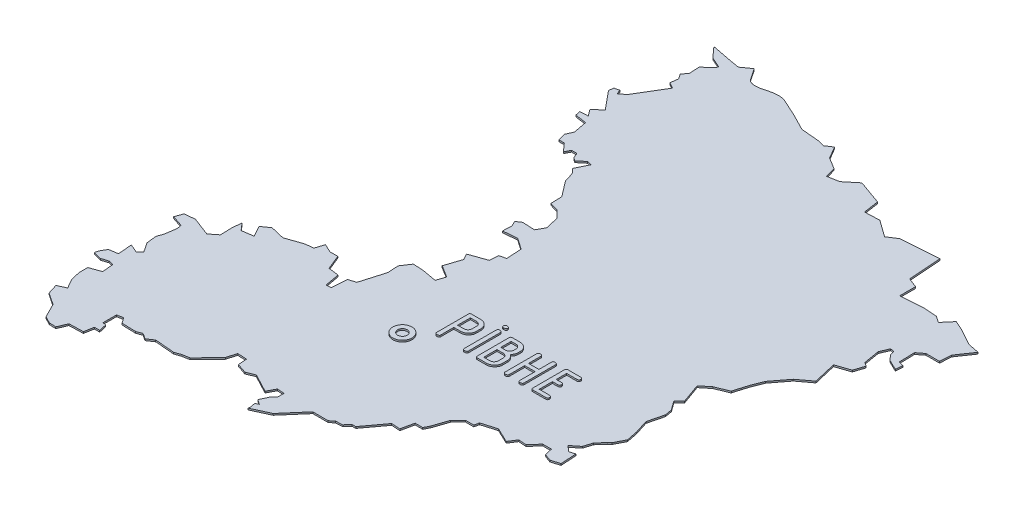
from build123d import *

# Parameters (mm, degrees)
EXTRUDE_1_DEPTH = 5
SKETCH_2_R      = 30
SKETCH_2_R_2    = 15
EXTRUDE_2_DEPTH = 10
SCALE_1_SCALE   = 0.05


with BuildPart() as part:
    # Эскиз1 → Бобышка-Вытянуть1 (new body)
    with BuildSketch(Plane(origin=(0, 0, 0), x_dir=(1, 0, 0), z_dir=(0, 1, 0))):
        with BuildLine():
            Line((-6732.93294, 8609.2792), (-6710.87304, 8600.84132))
            Line((-6710.87304, 8600.84132), (-6683.61884, 8609.2792))
            Line((-6683.61884, 8609.2792), (-6686.85734, 8658.57552))
            Line((-6686.85734, 8658.57552), (-6703.72802, 8653.39138))
            Line((-6703.72802, 8653.39138), (-6722.54434, 8668.97682))
            Line((-6722.54434, 8668.97682), (-6697.23578, 8689.086))
            Line((-6697.23578, 8689.086), (-6688.80298, 8716.35544))
            Line((-6688.80298, 8716.35544), (-6668.03848, 8739.05542))
            Line((-6668.03848, 8739.05542), (-6660.90362, 8745.54004))
            Line((-6660.90362, 8745.54004), (-6644.02786, 8777.99616))
            Line((-6644.02786, 8777.99616), (-6651.16272, 8813.69332))
            Line((-6651.16272, 8813.69332), (-6664.78728, 8856.50502))
            Line((-6664.78728, 8856.50502), (-6652.45812, 8905.84198))
            Line((-6652.45812, 8905.84198), (-6656.35194, 8927.90188))
            Line((-6656.35194, 8927.90188), (-6676.4789, 8955.80124))
            Line((-6676.4789, 8955.80124), (-6659.59806, 8972.68462))
            Line((-6659.59806, 8972.68462), (-6681.66812, 9034.31264))
            Line((-6681.66812, 9034.31264), (-6654.41392, 9056.37254))
            Line((-6654.41392, 9056.37254), (-6613.51484, 9073.26862))
            add(Edge.make_bspline(
                [(-6606.37744, 9098.56702), (-6610.27126, 9084.94246), (-6613.51484, 9073.26862)],
                knots=[0.914893617, 0.914893617, 0.914893617, 0.919148936, 0.919148936, 0.919148936], degree=2))
            add(Edge.make_bspline(
                [(-6586.2835, 9153.72566), (-6603.14402, 9112.83166), (-6606.37744, 9098.56702)],
                knots=[0.910638298, 0.910638298, 0.910638298, 0.914893617, 0.914893617, 0.914893617], degree=2))
            Line((-6586.2835, 9153.72566), (-6548.65086, 9203.03468))
            Line((-6548.65086, 9203.03468), (-6507.7467, 9233.5477))
            Line((-6507.7467, 9233.5477), (-6524.62246, 9305.57956))
            Line((-6524.62246, 9305.57956), (-6480.4925, 9320.50714))
            Line((-6480.4925, 9320.50714), (-6470.11914, 9352.95818))
            Line((-6470.11914, 9352.95818), (-6481.8006, 9361.38082))
            Line((-6481.8006, 9361.38082), (-6490.22832, 9411.35532))
            Line((-6490.22832, 9411.35532), (-6478.5621, 9438.61714))
            Line((-6478.5621, 9438.61714), (-6466.86794, 9436.65118))
            Line((-6466.86794, 9436.65118), (-6462.9792, 9423.04186))
            Line((-6462.9792, 9423.04186), (-6448.04654, 9406.14324))
            Line((-6448.04654, 9406.14324), (-6415.59042, 9390.58574))
            Line((-6415.59042, 9390.58574), (-6413.66002, 9412.65072))
            Line((-6413.66002, 9412.65072), (-6429.23276, 9416.55216))
            Line((-6429.23276, 9416.55216), (-6430.5307, 9465.85356))
            Line((-6430.5307, 9465.85356), (-6410.4139, 9481.4517))
            Line((-6410.4139, 9481.4517), (-6367.5895, 9481.4517))
            Line((-6367.5895, 9481.4517), (-6365.63878, 9517.126))
            Line((-6365.63878, 9517.126), (-6331.8771, 9566.45534))
            Line((-6331.8771, 9566.45534), (-6367.5895, 9573.58512))
            Line((-6367.5895, 9573.58512), (-6418.84924, 9602.13472))
            Line((-6418.84924, 9602.13472), (-6449.35464, 9615.78468))
            Line((-6449.35464, 9615.78468), (-6475.30328, 9585.26658))
            Line((-6475.30328, 9585.26658), (-6495.41754, 9598.89622))
            Line((-6495.41754, 9598.89622), (-6538.26226, 9602.13472))
            Line((-6538.26226, 9602.13472), (-6608.32562, 9596.9455))
            Line((-6608.32562, 9596.9455), (-6608.32562, 9646.92254))
            Line((-6608.32562, 9646.92254), (-6638.84118, 9658.60654))
            Line((-6638.84118, 9658.60654), (-6645.97858, 9761.13618))
            Line((-6645.97858, 9761.13618), (-6763.44596, 9752.69576))
            Line((-6763.44596, 9752.69576), (-6792.6331, 9733.88198))
            Line((-6792.6331, 9733.88198), (-6845.1984, 9771.51716))
            Line((-6845.1984, 9771.51716), (-6891.27908, 9769.54866))
            Line((-6891.27908, 9769.54866), (-6898.40886, 9817.58514))
            Line((-6898.40886, 9817.58514), (-6974.97716, 9844.84442))
            Line((-6974.97716, 9844.84442), (-7012.60726, 9813.69132))
            Line((-7012.60726, 9813.69132), (-7048.31458, 9807.2194))
            Line((-7048.31458, 9807.2194), (-7057.40778, 9839.65012))
            Line((-7057.40778, 9839.65012), (-7093.08716, 9861.72272))
            Line((-7093.08716, 9861.72272), (-7115.16484, 9899.38076))
            Line((-7115.16484, 9899.38076), (-7135.92426, 9885.72572))
            Line((-7135.92426, 9885.72572), (-7156.03852, 9890.92764))
            Line((-7156.03852, 9890.92764), (-7214.45852, 9896.11178))
            Line((-7214.45852, 9896.11178), (-7270.25216, 9924.66646))
            Line((-7270.25216, 9924.66646), (-7323.455, 9948.68978))
            add(Edge.make_bspline(
                [(-7379.91666, 9945.43604), (-7345.53522, 9955.81448), (-7323.455, 9948.68978)],
                knots=[0.714893617, 0.714893617, 0.714893617, 0.719148936, 0.719148936, 0.719148936], degree=2))
            add(Edge.make_bspline(
                [(-7429.25362, 9948.68978), (-7413.68088, 9935.05252), (-7379.91666, 9945.43604)],
                knots=[0.710638298, 0.710638298, 0.710638298, 0.714893617, 0.714893617, 0.714893617], degree=2))
            Line((-7429.25362, 9948.68978), (-7454.55456, 9986.31226))
            Line((-7454.55456, 9986.31226), (-7483.76456, 9965.54014))
            Line((-7483.76456, 9965.54014), (-7514.23948, 9970.72936))
            Line((-7514.23948, 9970.72936), (-7577.85378, 9983.07122))
            Line((-7577.85378, 9983.07122), (-7548.64886, 9950.63288))
            Line((-7548.64886, 9950.63288), (-7514.23948, 9935.05252))
            Line((-7514.23948, 9935.05252), (-7524.64332, 9921.42034))
            Line((-7524.64332, 9921.42034), (-7545.39004, 9904.5395))
            Line((-7545.39004, 9904.5395), (-7543.44694, 9872.08846))
            Line((-7543.44694, 9872.08846), (-7555.78626, 9855.23048))
            Line((-7555.78626, 9855.23048), (-7545.39004, 9839.65012))
            Line((-7545.39004, 9839.65012), (-7548.64886, 9815.64204))
            Line((-7548.64886, 9815.64204), (-7529.83254, 9805.2636))
            Line((-7529.83254, 9805.2636), (-7583.0303, 9716.99352))
            Line((-7583.0303, 9716.99352), (-7601.86186, 9702.72126))
            Line((-7601.86186, 9702.72126), (-7606.3983, 9716.99352))
            Line((-7606.3983, 9716.99352), (-7621.98374, 9713.10478))
            Line((-7621.98374, 9713.10478), (-7623.93954, 9698.18482))
            Line((-7623.93954, 9698.18482), (-7575.90814, 9639.78768))
            Line((-7575.90814, 9639.78768), (-7601.86186, 9617.72778))
            Line((-7601.86186, 9617.72778), (-7586.28658, 9596.9455))
            Line((-7586.28658, 9596.9455), (-7611.59768, 9595.64502))
            Line((-7611.59768, 9595.64502), (-7608.34648, 9580.08752))
            Line((-7608.34648, 9580.08752), (-7572.66202, 9574.89322))
            Line((-7572.66202, 9574.89322), (-7564.2216, 9532.05866))
            Line((-7564.2216, 9532.05866), (-7573.95488, 9509.99114))
            Line((-7573.95488, 9509.99114), (-7567.45756, 9485.98052))
            Line((-7567.45756, 9485.98052), (-7550.60212, 9485.98052))
            Line((-7550.60212, 9485.98052), (-7527.88436, 9460.67196))
            Line((-7527.88436, 9460.67196), (-7519.44394, 9477.5401))
            Line((-7519.44394, 9477.5401), (-7502.57834, 9477.5401))
            Line((-7502.57834, 9477.5401), (-7495.4384, 9460.67196))
            Line((-7495.4384, 9460.67196), (-7485.69242, 9454.1848))
            Line((-7485.69242, 9454.1848), (-7463.62998, 9472.36358))
            Line((-7463.62998, 9472.36358), (-7449.3755, 9469.11746))
            Line((-7449.3755, 9469.11746), (-7468.18928, 9430.15894))
            Line((-7468.18928, 9430.15894), (-7454.55456, 9414.60652))
            Line((-7454.55456, 9414.60652), (-7446.09382, 9385.39652))
            Line((-7446.09382, 9385.39652), (-7408.48658, 9336.0875))
            Line((-7408.48658, 9336.0875), (-7407.17848, 9300.38018))
            Line((-7407.17848, 9300.38018), (-7381.21206, 9293.25294))
            Line((-7381.21206, 9293.25294), (-7357.20906, 9269.24994))
            Line((-7357.20906, 9269.24994), (-7347.46562, 9228.3534))
            Line((-7347.46562, 9228.3534), (-7361.11304, 9203.03468))
            Line((-7361.11304, 9203.03468), (-7400.03854, 9204.9854))
            Line((-7400.03854, 9204.9854), (-7415.61382, 9194.61712))
            Line((-7415.61382, 9194.61712), (-7407.17848, 9179.03168))
            Line((-7407.17848, 9179.03168), (-7408.48658, 9149.83184))
            Line((-7408.48658, 9149.83184), (-7364.35408, 9153.72566))
            Line((-7364.35408, 9153.72566), (-7329.9574, 9129.70996))
            Line((-7329.9574, 9129.70996), (-7326.70112, 9081.69126))
            Line((-7326.70112, 9081.69126), (-7347.46562, 9076.50966))
            Line((-7347.46562, 9076.50966), (-7348.77372, 9049.26054))
            Line((-7348.77372, 9049.26054), (-7401.98672, 9030.42644))
            Line((-7401.98672, 9030.42644), (-7391.6032, 9011.61266))
            Line((-7391.6032, 9011.61266), (-7408.48658, 8960.35292))
            Line((-7408.48658, 8960.35292), (-7370.83362, 8936.97984))
            Line((-7370.83362, 8936.97984), (-7379.91666, 8909.71802))
            Line((-7379.91666, 8909.71802), (-7427.28766, 8918.16606))
            Line((-7427.28766, 8918.16606), (-7458.45346, 8919.46654))
            Line((-7458.45346, 8919.46654), (-7477.26216, 8890.90424))
            Line((-7477.26216, 8890.90424), (-7475.31144, 8856.50502))
            Line((-7475.31144, 8856.50502), (-7497.38912, 8781.2372))
            Line((-7497.38912, 8781.2372), (-7519.44394, 8774.73988))
            Line((-7519.44394, 8774.73988), (-7523.33522, 8726.70848))
            Line((-7523.33522, 8726.70848), (-7538.26788, 8725.43086))
            Line((-7538.26788, 8725.43086), (-7546.69814, 8771.50138))
            Line((-7546.69814, 8771.50138), (-7579.14156, 8776.0429))
            Line((-7579.14156, 8776.0429), (-7597.98074, 8822.11088))
            Line((-7597.98074, 8822.11088), (-7621.98374, 8822.11088))
            Line((-7621.98374, 8822.11088), (-7649.22778, 8834.45274))
            Line((-7649.22778, 8834.45274), (-7657.6682, 8807.20362))
            Line((-7657.6682, 8807.20362), (-7683.61684, 8803.93718))
            Line((-7683.61684, 8803.93718), (-7734.89182, 8786.43404))
            Line((-7734.89182, 8786.43404), (-7779.0294, 8796.80486))
            Line((-7779.0294, 8796.80486), (-7803.0324, 8779.93418))
            Line((-7803.0324, 8779.93418), (-7784.20592, 8745.54004))
            Line((-7784.20592, 8745.54004), (-7819.90816, 8740.36352))
            Line((-7819.90816, 8740.36352), (-7838.72702, 8762.40564))
            Line((-7838.72702, 8762.40564), (-7841.9579, 8735.16922))
            Line((-7841.9579, 8735.16922), (-7840.66504, 8696.22086))
            Line((-7840.66504, 8696.22086), (-7864.67566, 8677.402))
            Line((-7864.67566, 8677.402), (-7922.42002, 8699.47206))
            Line((-7922.42002, 8699.47206), (-7954.88122, 8696.22086))
            Line((-7954.88122, 8696.22086), (-7963.33688, 8672.2331))
            Line((-7963.33688, 8672.2331), (-7928.92242, 8660.5364))
            Line((-7928.92242, 8660.5364), (-7925.6763, 8646.90676))
            Line((-7925.6763, 8646.90676), (-7930.87314, 8610.56952))
            Line((-7930.87314, 8610.56952), (-7938.00038, 8590.44764))
            Line((-7938.00038, 8590.44764), (-7934.11926, 8559.292))
            Line((-7934.11926, 8559.292), (-7914.01008, 8528.80692))
            Line((-7914.01008, 8528.80692), (-7925.6763, 8517.12292))
            Line((-7925.6763, 8517.12292), (-7952.92796, 8528.80692))
            Line((-7952.92796, 8528.80692), (-7949.68692, 8484.68966))
            Line((-7949.68692, 8484.68966), (-7976.93604, 8480.77806))
            Line((-7976.93604, 8480.77806), (-7987.3348, 8462.60436))
            Line((-7987.3348, 8462.60436), (-7990.57076, 8450.26504))
            Line((-7990.57076, 8450.26504), (-7965.2622, 8443.7982))
            Line((-7965.2622, 8443.7982), (-7944.50278, 8450.26504))
            Line((-7944.50278, 8450.26504), (-7928.92242, 8447.04178))
            Line((-7928.92242, 8447.04178), (-7925.6763, 8411.337))
            Line((-7925.6763, 8411.337), (-7960.07298, 8399.02308))
            Line((-7960.07298, 8399.02308), (-7960.07298, 8371.75872))
            Line((-7960.07298, 8371.75872), (-7952.92796, 8341.2584))
            Line((-7952.92796, 8341.2584), (-7936.04966, 8312.04586))
            Line((-7936.04966, 8312.04586), (-7961.37346, 8300.37202))
            Line((-7961.37346, 8300.37202), (-7951.62494, 8269.22654))
            Line((-7951.62494, 8269.22654), (-7914.01008, 8243.92306))
            Line((-7914.01008, 8243.92306), (-7891.94256, 8199.78548))
            Line((-7891.94256, 8199.78548), (-7870.5075, 8188.75934))
            Line((-7870.5075, 8188.75934), (-7849.10038, 8187.45632))
            Line((-7849.10038, 8187.45632), (-7836.76868, 8216.66632))
            Line((-7836.76868, 8216.66632), (-7792.64634, 8217.95918))
            Line((-7792.64634, 8217.95918), (-7787.44696, 8247.17426))
            Line((-7787.44696, 8247.17426), (-7770.59406, 8247.17426))
            Line((-7770.59406, 8247.17426), (-7775.7655, 8271.17726))
            Line((-7775.7655, 8271.17726), (-7786.16426, 8273.11528))
            Line((-7786.16426, 8273.11528), (-7786.16426, 8315.30976))
            Line((-7786.16426, 8315.30976), (-7767.34794, 8319.1858))
            Line((-7767.34794, 8319.1858), (-7755.0137, 8301.6725))
            Line((-7755.0137, 8301.6725), (-7710.89644, 8300.37202))
            Line((-7710.89644, 8300.37202), (-7694.01814, 8306.8668))
            Line((-7694.01814, 8306.8668), (-7676.49468, 8295.1828))
            Line((-7676.49468, 8295.1828), (-7656.3728, 8308.8099))
            Line((-7656.3728, 8308.8099), (-7594.72192, 8303.62322))
            Line((-7594.72192, 8303.62322), (-7575.90814, 8310.118))
            Line((-7575.90814, 8310.118), (-7553.84316, 8314.00674))
            Line((-7553.84316, 8314.00674), (-7499.33984, 8370.47348))
            Line((-7499.33984, 8370.47348), (-7490.9045, 8400.9611))
            Line((-7490.9045, 8400.9611), (-7461.69196, 8399.02308))
            Line((-7461.69196, 8399.02308), (-7459.74378, 8371.75872))
            Line((-7459.74378, 8371.75872), (-7429.25362, 8361.38028))
            Line((-7429.25362, 8361.38028), (-7403.28212, 8371.75872))
            Line((-7403.28212, 8371.75872), (-7345.53522, 8341.2584))
            Line((-7345.53522, 8341.2584), (-7331.89542, 8366.57458))
            Line((-7331.89542, 8366.57458), (-7309.84822, 8365.26648))
            Line((-7309.84822, 8365.26648), (-7309.84822, 8346.45778))
            Line((-7309.84822, 8346.45778), (-7320.2165, 8336.08442))
            Line((-7320.2165, 8336.08442), (-7333.84868, 8306.8668))
            Line((-7333.84868, 8306.8668), (-7318.27848, 8296.47058))
            Line((-7318.27848, 8296.47058), (-7328.65184, 8291.94176))
            Line((-7328.65184, 8291.94176), (-7324.75802, 8276.35632))
            Line((-7324.75802, 8276.35632), (-7326.06612, 8268.57884))
            Line((-7326.06612, 8268.57884), (-7272.19018, 8293.23716))
            Line((-7272.19018, 8293.23716), (-7214.45852, 8360.07218))
            Line((-7214.45852, 8360.07218), (-7166.42712, 8360.07218))
            Line((-7166.42712, 8360.07218), (-7152.78478, 8370.47348))
            Line((-7152.78478, 8370.47348), (-7132.02282, 8371.75872))
            Line((-7132.02282, 8371.75872), (-7118.41096, 8387.33654))
            Line((-7118.41096, 8387.33654), (-7106.70664, 8387.33654))
            Line((-7106.70664, 8387.33654), (-7058.68794, 8452.21322))
            Line((-7058.68794, 8452.21322), (-7031.45406, 8450.26504))
            Line((-7031.45406, 8450.26504), (-7023.00856, 8489.8738))
            Line((-7023.00856, 8489.8738), (-6999.00302, 8489.8738))
            Line((-6999.00302, 8489.8738), (-6990.56514, 8506.74194))
            Line((-6990.56514, 8506.74194), (-6974.97716, 8552.81246))
            Line((-6974.97716, 8552.81246), (-6951.61678, 8576.83324))
            Line((-6951.61678, 8576.83324), (-6925.65544, 8576.83324))
            Line((-6925.65544, 8576.83324), (-6922.40678, 8591.74812))
            Line((-6922.40678, 8591.74812), (-6876.3642, 8605.3676))
            Line((-6876.3642, 8605.3676), (-6830.26574, 8583.3077))
            Line((-6830.26574, 8583.3077), (-6814.69046, 8607.32086))
            Line((-6814.69046, 8607.32086), (-6790.68238, 8605.3676))
            Line((-6790.68238, 8605.3676), (-6765.37128, 8633.27966))
            Line((-6765.37128, 8633.27966), (-6738.13486, 8633.27966))
            Line((-6738.13486, 8633.27966), (-6732.93294, 8609.2792))
        make_face()
    extrude(amount=EXTRUDE_1_DEPTH)

    # Эскиз2 → Бобышка-Вытянуть2 (add)
    # profile 1 of 7: a face of its own
    with BuildSketch(Plane(origin=(0, 0, 0), x_dir=(1, 0, 0), z_dir=(0, 1, 0))):
        with Locations((-7284.487874878, 8711.551338167)):
            Circle(SKETCH_2_R)
        with Locations((-7284.487874878, 8711.551338167)):
            Circle(SKETCH_2_R_2, mode=Mode.SUBTRACT)
    # profile 2 of 7: a face of its own
    with BuildSketch(Plane(origin=(0, 0, 0), x_dir=(1, 0, 0), z_dir=(0, 1, 0))):
        with BuildLine():
            Line((-7217.592863068, 8806.062785371), (-7217.592863068, 8765.30053875))
            add(Edge.make_bspline(
                [(-7217.592863068, 8765.30053875), (-7217.611304209, 8764.879284244), (-7217.646198195, 8764.082194279), (-7218.014926466, 8762.968559189), (-7218.59727321, 8762.012744442), (-7219.451860644, 8761.249927037), (-7220.526456164, 8760.669117692), (-7221.824445643, 8760.252649125), (-7223.353883844, 8760.040077429), (-7224.444059997, 8760.002003623), (-7225.0252955, 8759.98170429)],
                knots=[0, 0, 0, 0, 0.969647621, 1.834749252, 2.678145047, 3.526077294, 4.446504318, 5.481227067, 6.657097526, 8, 8, 8, 8], degree=3))
            add(Edge.make_bspline(
                [(-7225.0252955, 8759.98170429), (-7225.490553924, 8760.001981841), (-7226.365515249, 8760.040115644), (-7227.597273432, 8760.255393411), (-7228.641217934, 8760.677563574), (-7229.504421752, 8761.266956602), (-7230.183877964, 8762.037716429), (-7230.639483304, 8762.986867721), (-7230.9294974, 8764.091392324), (-7230.956736686, 8764.880397906), (-7230.971241446, 8765.30053875)],
                knots=[0, 0, 0, 0, 1.22289028, 2.299757822, 3.266537475, 4.157864275, 5.022578284, 5.932048079, 6.898827733, 8, 8, 8, 8], degree=3))
            Line((-7230.971241446, 8765.30053875), (-7230.971241446, 8864.662869831))
            add(Edge.make_bspline(
                [(-7230.971241446, 8864.662869831), (-7230.954859504, 8865.082668509), (-7230.924168328, 8865.869151285), (-7230.660203114, 8866.969690974), (-7230.253731033, 8867.912958884), (-7229.65038393, 8868.694070153), (-7228.85880179, 8869.278938553), (-7227.910002173, 8869.70585097), (-7226.7845348, 8869.924542846), (-7225.986138424, 8869.96179693), (-7225.559501581, 8869.98170429)],
                knots=[0, 0, 0, 0, 1.157077194, 2.167756429, 3.10506564, 3.97280776, 4.857486845, 5.794796055, 6.821611322, 8, 8, 8, 8], degree=3))
            Line((-7225.559501581, 8869.98170429), (-7198.105954284, 8869.98170429))
            add(Edge.make_bspline(
                [(-7198.105954284, 8869.98170429), (-7197.175499892, 8869.961564268), (-7195.354267809, 8869.92214304), (-7192.684614611, 8869.548173566), (-7190.122260249, 8869.02035552), (-7187.693733441, 8868.175027555), (-7185.353740625, 8867.178177889), (-7183.168640109, 8865.865261207), (-7181.062668794, 8864.394850604), (-7179.137665594, 8862.667987365), (-7177.352451209, 8860.832574123), (-7175.79831205, 8858.886342885), (-7174.481151521, 8856.86128463), (-7173.381879309, 8854.776869837), (-7172.535522686, 8852.603046042), (-7171.966986929, 8850.346467353), (-7171.570380374, 8848.031236694), (-7171.531369162, 8846.45508559), (-7171.511781987, 8845.663714425)],
                knots=[0, 0, 0, 0, 1.115359705, 2.183157925, 3.228715987, 4.24774915, 5.262329495, 6.273717254, 7.299288291, 8.338890594, 9.370038504, 10.367862649, 11.320905581, 12.263804873, 13.189908176, 14.111156383, 15.051628764, 16, 16, 16, 16], degree=3))
            Line((-7171.511781987, 8845.663714425), (-7171.511781987, 8830.311096182))
            add(Edge.make_bspline(
                [(-7171.511781987, 8830.311096182), (-7171.533570809, 8829.52008595), (-7171.576723322, 8827.953499259), (-7171.937824636, 8825.641575581), (-7172.517567355, 8823.399127483), (-7173.338077184, 8821.228408453), (-7174.38218889, 8819.130423969), (-7175.684567748, 8817.120237497), (-7177.186234993, 8815.164870581), (-7178.929009661, 8813.332258944), (-7180.79944455, 8811.603341712), (-7182.86660058, 8810.155443769), (-7185.010603237, 8808.870656789), (-7187.303415702, 8807.863030041), (-7189.697452714, 8807.029171261), (-7192.226851249, 8806.492925313), (-7194.858889978, 8806.12401528), (-7196.656837356, 8806.083435145), (-7197.571748203, 8806.062785371)],
                knots=[0, 0, 0, 0, 0.959067182, 1.899421552, 2.831059805, 3.764258791, 4.709244439, 5.667943704, 6.665417502, 7.695258647, 8.732566372, 9.748959613, 10.750800674, 11.759659972, 12.7812896, 13.820296438, 14.890827142, 16, 16, 16, 16], degree=3))
            Line((-7197.571748203, 8806.062785371), (-7217.592863068, 8806.062785371))
        make_face()
        with BuildLine():
            Line((-7217.592863068, 8817.954677263), (-7198.314991446, 8817.954677263))
            add(Edge.make_bspline(
                [(-7198.314991446, 8817.954677263), (-7197.426856432, 8817.994693544), (-7195.68161219, 8818.073328192), (-7193.184651367, 8818.833716554), (-7190.86880651, 8820.017224621), (-7188.819553005, 8821.657938573), (-7187.074036988, 8823.597711391), (-7185.810938566, 8825.814428687), (-7185.036664496, 8828.224394276), (-7184.939392305, 8829.902874924), (-7184.890160365, 8830.752396858)],
                knots=[0, 0, 0, 0, 1.033886494, 2.031655573, 3.017574438, 4.053235711, 5.077365722, 6.044435782, 7.010238993, 8, 8, 8, 8], degree=3))
            Line((-7184.890160365, 8830.752396858), (-7184.890160365, 8845.22241375))
            add(Edge.make_bspline(
                [(-7184.890160365, 8845.22241375), (-7184.939969846, 8846.071598866), (-7185.038383138, 8847.749414031), (-7185.805434561, 8850.168002592), (-7187.107135092, 8852.373626247), (-7188.838302032, 8854.331812309), (-7190.874367504, 8856.015550785), (-7193.191748294, 8857.203093948), (-7195.688281573, 8857.974087927), (-7197.426593749, 8858.050672425), (-7198.314991446, 8858.089812398)],
                knots=[0, 0, 0, 0, 0.988107596, 1.952297418, 2.922249424, 3.951448995, 4.983962972, 5.98039188, 6.967840629, 8, 8, 8, 8], degree=3))
            Line((-7198.314991446, 8858.089812398), (-7217.592863068, 8858.089812398))
            Line((-7217.592863068, 8858.089812398), (-7217.592863068, 8817.954677263))
        make_face(mode=Mode.SUBTRACT)
    # profile 3 of 7: a face of its own
    with BuildSketch(Plane(origin=(0, 0, 0), x_dir=(1, 0, 0), z_dir=(0, 1, 0))):
        with BuildLine():
            add(Edge.make_bspline(
                [(-7130.484754959, 8765.323765101), (-7130.504719258, 8764.903077801), (-7130.54284569, 8764.099678417), (-7130.894876668, 8762.97829843), (-7131.497104348, 8762.032285915), (-7132.348892144, 8761.275902038), (-7133.411018735, 8760.66341415), (-7134.717513307, 8760.254848964), (-7136.245414805, 8760.039402137), (-7137.335826375, 8760.001768789), (-7137.917187392, 8759.98170429)],
                knots=[0, 0, 0, 0, 0.968349646, 1.849286893, 2.676465977, 3.523263178, 4.451261044, 5.484598709, 6.658895142, 8, 8, 8, 8], degree=3))
            add(Edge.make_bspline(
                [(-7137.917187392, 8759.98170429), (-7138.382572889, 8760.001796095), (-7139.257773186, 8760.039580585), (-7140.487955799, 8760.257161405), (-7141.541216731, 8760.673515565), (-7142.390158453, 8761.292025807), (-7143.069142873, 8762.055602517), (-7143.541656145, 8762.998446479), (-7143.817258863, 8764.108248113), (-7143.847291812, 8764.904018754), (-7143.863133338, 8765.323765101)],
                knots=[0, 0, 0, 0, 1.220860227, 2.29594012, 3.261114875, 4.162696787, 5.025975332, 5.915822489, 6.900655729, 8, 8, 8, 8], degree=3))
            Line((-7143.863133338, 8765.323765101), (-7143.863133338, 8865.33643402))
            add(Edge.make_bspline(
                [(-7143.863133338, 8865.33643402), (-7143.84711602, 8865.756012063), (-7143.816749798, 8866.551463627), (-7143.543376297, 8867.663399526), (-7143.060739121, 8868.604388769), (-7142.405985778, 8869.393640527), (-7141.531703687, 8869.981539216), (-7140.489600799, 8870.405145239), (-7139.25727535, 8870.619980724), (-7138.382400065, 8870.658181609), (-7137.917187392, 8870.678494831)],
                knots=[0, 0, 0, 0, 1.098843442, 2.08322802, 2.972669788, 3.850929026, 4.740370794, 5.705105844, 6.779695961, 8, 8, 8, 8], degree=3))
            add(Edge.make_bspline(
                [(-7137.917187392, 8870.678494831), (-7137.33601047, 8870.658139097), (-7136.245944192, 8870.619959503), (-7134.71578877, 8870.408078344), (-7133.420056971, 8869.989436094), (-7132.333618171, 8869.413018051), (-7131.50518545, 8868.62625222), (-7130.893412149, 8867.683629773), (-7130.543265053, 8866.560025585), (-7130.504863383, 8865.75695116), (-7130.484754959, 8865.33643402)],
                knots=[0, 0, 0, 0, 1.340544031, 2.514349394, 3.547254935, 4.466065479, 5.324653274, 6.151486447, 7.032055301, 8, 8, 8, 8], degree=3))
            Line((-7130.484754959, 8865.33643402), (-7130.484754959, 8765.323765101))
        make_face()
    # profile 4 of 7: a face of its own
    with BuildSketch(Plane(origin=(0, 0, 0), x_dir=(1, 0, 0), z_dir=(0, 1, 0))):
        with BuildLine():
            add(Edge.make_bspline(
                [(-7137.917187392, 8893.765488074), (-7137.335951889, 8893.745188742), (-7136.245775736, 8893.707114935), (-7134.716337535, 8893.494543239), (-7133.418348056, 8893.078074672), (-7132.343752536, 8892.497265327), (-7131.489165101, 8891.734447923), (-7130.906818358, 8890.778633176), (-7130.538090087, 8889.664998086), (-7130.503196101, 8888.86790812), (-7130.484754959, 8888.446653615)],
                knots=[0, 0, 0, 0, 1.342902474, 2.518772933, 3.553495682, 4.473922706, 5.321854953, 6.165250748, 7.030352379, 8, 8, 8, 8], degree=3))
            add(Edge.make_bspline(
                [(-7130.484754959, 8888.446653615), (-7130.503715641, 8888.018025879), (-7130.539614408, 8887.206493495), (-7130.899912915, 8886.072736177), (-7131.496875742, 8885.11267397), (-7132.33469259, 8884.324616299), (-7133.419486757, 8883.745437291), (-7134.718208849, 8883.335269881), (-7136.243217144, 8883.084439079), (-7137.335491629, 8883.052123539), (-7137.917187392, 8883.03491375)],
                knots=[0, 0, 0, 0, 0.981339183, 1.857995784, 2.696169867, 3.550943068, 4.465671455, 5.493987931, 6.665411832, 8, 8, 8, 8], degree=3))
            add(Edge.make_bspline(
                [(-7137.917187392, 8883.03491375), (-7138.383024699, 8883.052174532), (-7139.260607905, 8883.084691835), (-7140.486662857, 8883.338047656), (-7141.532264636, 8883.753327576), (-7142.405132275, 8884.34379751), (-7143.068098605, 8885.136080656), (-7143.537455343, 8886.091836474), (-7143.819893585, 8887.215333707), (-7143.848117634, 8888.019057864), (-7143.863133338, 8888.446653615)],
                knots=[0, 0, 0, 0, 1.213876563, 2.286801999, 3.246455683, 4.131212664, 5.004846013, 5.90761226, 6.886811976, 8, 8, 8, 8], degree=3))
            add(Edge.make_bspline(
                [(-7143.863133338, 8888.446653615), (-7143.848628578, 8888.866794459), (-7143.821389291, 8889.655800041), (-7143.531375196, 8890.760324643), (-7143.075769855, 8891.709475936), (-7142.396313644, 8892.480235762), (-7141.533109825, 8893.06962879), (-7140.489165324, 8893.491798953), (-7139.257407141, 8893.707076721), (-7138.382445816, 8893.745210523), (-7137.917187392, 8893.765488074)],
                knots=[0, 0, 0, 0, 1.101172267, 2.067951921, 2.977421716, 3.842135725, 4.733462525, 5.700242178, 6.77710972, 8, 8, 8, 8], degree=3))
        make_face()
    # profile 5 of 7: a face of its own
    with BuildSketch(Plane(origin=(0, 0, 0), x_dir=(1, 0, 0), z_dir=(0, 1, 0))):
        with BuildLine():
            add(Edge.make_bspline(
                [(-7097.424366446, 8759.98170429), (-7097.851003289, 8760.001611651), (-7098.649399665, 8760.038865735), (-7099.774867038, 8760.257557611), (-7100.723666655, 8760.684470028), (-7101.515248795, 8761.269338427), (-7102.118595897, 8762.050449697), (-7102.525067979, 8762.993717607), (-7102.789033193, 8764.094257296), (-7102.819724369, 8764.880740072), (-7102.836106311, 8765.30053875)],
                knots=[0, 0, 0, 0, 1.178388678, 2.205203945, 3.142513155, 4.02719224, 4.89493436, 5.832243571, 6.842922806, 8, 8, 8, 8], degree=3))
            Line((-7102.836106311, 8765.30053875), (-7102.836106311, 8864.662869831))
            add(Edge.make_bspline(
                [(-7102.836106311, 8864.662869831), (-7102.81686545, 8865.082135085), (-7102.78089723, 8865.865895502), (-7102.55311744, 8866.971393017), (-7102.144182514, 8867.922307972), (-7101.515222646, 8868.678324691), (-7100.746314814, 8869.287471878), (-7099.796558299, 8869.704056231), (-7098.680708162, 8869.92348461), (-7097.889839711, 8869.961541083), (-7097.470819149, 8869.98170429)],
                knots=[0, 0, 0, 0, 1.161386961, 2.171057864, 3.111858271, 3.996198585, 4.867172785, 5.807973192, 6.838613039, 8, 8, 8, 8], degree=3))
            Line((-7097.470819149, 8869.98170429), (-7074.128336041, 8869.98170429))
            add(Edge.make_bspline(
                [(-7074.128336041, 8869.98170429), (-7073.205682493, 8869.961370584), (-7071.399989488, 8869.921576199), (-7068.752492903, 8869.550465886), (-7066.21925, 8869.012594631), (-7063.802820622, 8868.206560218), (-7061.499812141, 8867.194182288), (-7059.321942002, 8865.917132606), (-7057.25556339, 8864.438047062), (-7055.344689546, 8862.739388515), (-7053.584132855, 8860.924980607), (-7052.052477592, 8859.002472882), (-7050.759276028, 8857.000252669), (-7049.684256782, 8854.945469139), (-7048.869046404, 8852.797562446), (-7048.257945166, 8850.600266768), (-7047.901252487, 8848.31540699), (-7047.858036453, 8846.772060446), (-7047.836106311, 8845.988883344)],
                knots=[0, 0, 0, 0, 1.11995412, 2.191823057, 3.241309871, 4.261230133, 5.279935998, 6.291149995, 7.321935457, 8.361305785, 9.392091246, 10.389217116, 11.341206678, 12.283252909, 13.200041413, 14.126185389, 15.049125615, 16, 16, 16, 16], degree=3))
            Line((-7047.836106311, 8845.988883344), (-7047.836106311, 8838.509998209))
            add(Edge.make_bspline(
                [(-7047.836106311, 8838.509998209), (-7047.866295923, 8837.626239152), (-7047.925620043, 8835.889607779), (-7048.29014441, 8833.353860764), (-7048.939960559, 8830.955459814), (-7049.893615612, 8828.717855179), (-7051.037193694, 8826.580326587), (-7052.515244494, 8824.62497916), (-7054.196895673, 8822.768928263), (-7055.509054402, 8821.701260176), (-7056.174366446, 8821.15991375)],
                knots=[0, 0, 0, 0, 1.061275997, 2.085461165, 3.06879059, 4.035634009, 5.000911834, 5.971502377, 6.971478167, 8, 8, 8, 8], degree=3))
            add(Edge.make_bspline(
                [(-7056.174366446, 8821.15991375), (-7055.280834131, 8820.709985963), (-7053.478913837, 8819.802649991), (-7051.073664194, 8817.855403822), (-7048.868754043, 8815.523229276), (-7046.991144875, 8812.773693005), (-7045.395620544, 8809.82265622), (-7044.206925608, 8806.730591345), (-7043.517809648, 8803.53829073), (-7043.423735098, 8801.381975963), (-7043.376646851, 8800.302650236)],
                knots=[0, 0, 0, 0, 0.930523516, 1.876517703, 2.867344312, 3.914784832, 4.97094674, 5.989987574, 6.993904713, 8, 8, 8, 8], degree=3))
            Line((-7043.376646851, 8800.302650236), (-7043.376646851, 8784.764221182))
            add(Edge.make_bspline(
                [(-7043.376646851, 8784.764221182), (-7043.396519351, 8783.996097792), (-7043.436100872, 8782.466169892), (-7043.831474642, 8780.20252155), (-7044.428666371, 8777.979475652), (-7045.299366043, 8775.808122385), (-7046.417182119, 8773.69364977), (-7047.788457972, 8771.638994007), (-7049.360071543, 8769.60958524), (-7051.186206452, 8767.688793747), (-7053.156514792, 8765.89147425), (-7055.250750603, 8764.291951396), (-7057.472313574, 8762.972258883), (-7059.775561119, 8761.866054597), (-7062.186421788, 8761.031850811), (-7064.690168117, 8760.427006788), (-7067.295489962, 8760.040297978), (-7069.071371947, 8760.001403522), (-7069.970819149, 8759.98170429)],
                knots=[0, 0, 0, 0, 0.917949901, 1.828348392, 2.740440823, 3.667315706, 4.620059285, 5.596056403, 6.618609543, 7.686452614, 8.761618673, 9.806200413, 10.83214442, 11.846994998, 12.857399563, 13.877097342, 14.924794062, 16, 16, 16, 16], degree=3))
            Line((-7069.970819149, 8759.98170429), (-7097.424366446, 8759.98170429))
        make_face()
        with BuildLine():
            Line((-7089.457727932, 8825.387109696), (-7074.267694149, 8825.387109696))
            add(Edge.make_bspline(
                [(-7074.267694149, 8825.387109696), (-7073.402677753, 8825.4272323), (-7071.702803117, 8825.506078663), (-7069.263585791, 8826.268593463), (-7067.007251248, 8827.470974658), (-7065.021535645, 8829.146389035), (-7063.333139489, 8831.104895018), (-7062.091702779, 8833.311476778), (-7061.337352981, 8835.705300788), (-7061.255797766, 8837.366532556), (-7061.214484689, 8838.208055642)],
                knots=[0, 0, 0, 0, 1.021027334, 2.006457305, 2.99426919, 4.028852023, 5.062298486, 6.038443649, 7.006342773, 8, 8, 8, 8], degree=3))
            Line((-7061.214484689, 8838.208055642), (-7061.214484689, 8845.338545507))
            add(Edge.make_bspline(
                [(-7061.214484689, 8845.338545507), (-7061.256070616, 8846.179928036), (-7061.338164458, 8847.840882335), (-7062.086503794, 8850.230238772), (-7063.335025889, 8852.418770981), (-7065.021525996, 8854.356244734), (-7067.01463901, 8856.004409073), (-7069.262796258, 8857.209337284), (-7071.703008634, 8857.970580877), (-7073.402747064, 8858.049601247), (-7074.267694149, 8858.089812398)],
                knots=[0, 0, 0, 0, 0.996243721, 1.966662291, 2.937341644, 3.966492765, 4.997936714, 5.988319878, 6.976314928, 8, 8, 8, 8], degree=3))
            Line((-7074.267694149, 8858.089812398), (-7089.457727932, 8858.089812398))
            Line((-7089.457727932, 8858.089812398), (-7089.457727932, 8825.387109696))
        make_face(mode=Mode.SUBTRACT)
        with BuildLine():
            Line((-7089.457727932, 8771.873596182), (-7070.179856311, 8771.873596182))
            add(Edge.make_bspline(
                [(-7070.179856311, 8771.873596182), (-7069.284572618, 8771.923789855), (-7067.533411394, 8772.021967913), (-7065.00348683, 8772.767819169), (-7062.693248117, 8774.026510824), (-7060.646401767, 8775.742608712), (-7058.935513006, 8777.794805733), (-7057.644198593, 8780.091977761), (-7056.904997755, 8782.629610395), (-7056.805760447, 8784.38020626), (-7056.75502523, 8785.275200912)],
                knots=[0, 0, 0, 0, 1.019269311, 1.9936752, 2.976671234, 3.99788619, 5.019101147, 6.0063248, 6.980730689, 8, 8, 8, 8], degree=3))
            Line((-7056.75502523, 8785.275200912), (-7056.75502523, 8800.163292128))
            add(Edge.make_bspline(
                [(-7056.75502523, 8800.163292128), (-7056.806008039, 8801.058187046), (-7056.905729636, 8802.808587832), (-7057.639500777, 8805.341066161), (-7058.935842372, 8807.622608219), (-7060.654748596, 8809.648870411), (-7062.681762055, 8811.365342379), (-7065.002399752, 8812.598530696), (-7067.520696558, 8813.38069387), (-7069.28376263, 8813.456625097), (-7070.179856311, 8813.495217804)],
                knots=[0, 0, 0, 0, 1.021347402, 1.997739913, 2.979242372, 3.995757054, 5.019054068, 5.992078592, 6.979456463, 8, 8, 8, 8], degree=3))
            Line((-7070.179856311, 8813.495217804), (-7089.457727932, 8813.495217804))
            Line((-7089.457727932, 8813.495217804), (-7089.457727932, 8771.873596182))
        make_face(mode=Mode.SUBTRACT)
    # profile 6 of 7: a face of its own
    with BuildSketch(Plane(origin=(0, 0, 0), x_dir=(1, 0, 0), z_dir=(0, 1, 0))):
        with BuildLine():
            Line((-6969.646917122, 8825.387109696), (-6969.646917122, 8864.779001588))
            add(Edge.make_bspline(
                [(-6969.646917122, 8864.779001588), (-6969.632508141, 8865.191505047), (-6969.605473508, 8865.965458436), (-6969.314814276, 8867.046562823), (-6968.860085627, 8867.975660977), (-6968.171147829, 8868.717627511), (-6967.323344944, 8869.31713256), (-6966.263628167, 8869.692406286), (-6965.046342556, 8869.963160864), (-6964.1673464, 8869.975276181), (-6963.700971176, 8869.98170429)],
                knots=[0, 0, 0, 0, 1.091529518, 2.047965782, 2.948064081, 3.805939007, 4.706037306, 5.674741692, 6.76627121, 8, 8, 8, 8], degree=3))
            add(Edge.make_bspline(
                [(-6963.700971176, 8869.98170429), (-6963.119735673, 8869.961404958), (-6962.02955952, 8869.923331152), (-6960.500121319, 8869.710759455), (-6959.202131839, 8869.294290888), (-6958.12753632, 8868.713481544), (-6957.272948885, 8867.950664139), (-6956.690602142, 8866.994849392), (-6956.32187387, 8865.881214302), (-6956.286979885, 8865.084124336), (-6956.268538743, 8864.662869831)],
                knots=[0, 0, 0, 0, 1.342902474, 2.518772933, 3.553495682, 4.473922706, 5.321854953, 6.165250748, 7.030352379, 8, 8, 8, 8], degree=3))
            Line((-6956.268538743, 8864.662869831), (-6956.268538743, 8765.30053875))
            add(Edge.make_bspline(
                [(-6956.268538743, 8765.30053875), (-6956.286979885, 8764.879284244), (-6956.32187387, 8764.082194279), (-6956.690602142, 8762.968559189), (-6957.272948885, 8762.012744442), (-6958.12753632, 8761.249927037), (-6959.202131839, 8760.669117692), (-6960.500121319, 8760.252649125), (-6962.02955952, 8760.040077429), (-6963.119735673, 8760.002003623), (-6963.700971176, 8759.98170429)],
                knots=[0, 0, 0, 0, 0.969647621, 1.834749252, 2.678145047, 3.526077294, 4.446504318, 5.481227067, 6.657097526, 8, 8, 8, 8], degree=3))
            add(Edge.make_bspline(
                [(-6963.700971176, 8759.98170429), (-6964.1662296, 8760.001981841), (-6965.041190924, 8760.040115644), (-6966.272949108, 8760.255393411), (-6967.316893609, 8760.677563574), (-6968.180097428, 8761.266956602), (-6968.859553639, 8762.037716429), (-6969.31515898, 8762.986867721), (-6969.605173075, 8764.091392324), (-6969.632412362, 8764.880397906), (-6969.646917122, 8765.30053875)],
                knots=[0, 0, 0, 0, 1.22289028, 2.299757822, 3.266537475, 4.157864275, 5.022578284, 5.932048079, 6.898827733, 8, 8, 8, 8], degree=3))
            Line((-6969.646917122, 8765.30053875), (-6969.646917122, 8813.495217804))
            Line((-6969.646917122, 8813.495217804), (-7002.349619824, 8813.495217804))
            Line((-7002.349619824, 8813.495217804), (-7002.349619824, 8765.30053875))
            add(Edge.make_bspline(
                [(-7002.349619824, 8765.30053875), (-7002.368060966, 8764.879284244), (-7002.402954952, 8764.082194279), (-7002.771683223, 8762.968559189), (-7003.354029966, 8762.012744442), (-7004.208617401, 8761.249927037), (-7005.28321292, 8760.669117692), (-7006.5812024, 8760.252649125), (-7008.110640601, 8760.040077429), (-7009.200816754, 8760.002003623), (-7009.782052257, 8759.98170429)],
                knots=[0, 0, 0, 0, 0.969647621, 1.834749252, 2.678145047, 3.526077294, 4.446504318, 5.481227067, 6.657097526, 8, 8, 8, 8], degree=3))
            add(Edge.make_bspline(
                [(-7009.782052257, 8759.98170429), (-7010.247310681, 8760.001981841), (-7011.122272005, 8760.040115644), (-7012.354030189, 8760.255393411), (-7013.39797469, 8760.677563574), (-7014.261178509, 8761.266956602), (-7014.94063472, 8762.037716429), (-7015.396240061, 8762.986867721), (-7015.686254156, 8764.091392324), (-7015.713493443, 8764.880397906), (-7015.727998203, 8765.30053875)],
                knots=[0, 0, 0, 0, 1.22289028, 2.299757822, 3.266537475, 4.157864275, 5.022578284, 5.932048079, 6.898827733, 8, 8, 8, 8], degree=3))
            Line((-7015.727998203, 8765.30053875), (-7015.727998203, 8864.662869831))
            add(Edge.make_bspline(
                [(-7015.727998203, 8864.662869831), (-7015.713493443, 8865.083010675), (-7015.686254156, 8865.872016257), (-7015.396240061, 8866.97654086), (-7014.94063472, 8867.925692152), (-7014.261178509, 8868.696451978), (-7013.39797469, 8869.285845007), (-7012.354030189, 8869.708015169), (-7011.122272005, 8869.923292937), (-7010.247310681, 8869.961426739), (-7009.782052257, 8869.98170429)],
                knots=[0, 0, 0, 0, 1.101172267, 2.067951921, 2.977421716, 3.842135725, 4.733462525, 5.700242178, 6.77710972, 8, 8, 8, 8], degree=3))
            add(Edge.make_bspline(
                [(-7009.782052257, 8869.98170429), (-7009.199868146, 8869.97546639), (-7008.106359317, 8869.963749824), (-7006.589079419, 8869.694026878), (-7005.277583183, 8869.326381233), (-7004.217289579, 8868.732951729), (-7003.354523699, 8868.000516212), (-7002.772248305, 8867.065240127), (-7002.402679231, 8865.974829597), (-7002.367972953, 8865.192635777), (-7002.349619824, 8864.779001588)],
                knots=[0, 0, 0, 0, 1.353106154, 2.541521659, 3.579288285, 4.507284885, 5.350131461, 6.185231121, 7.040326791, 8, 8, 8, 8], degree=3))
            Line((-7002.349619824, 8864.779001588), (-7002.349619824, 8825.387109696))
            Line((-7002.349619824, 8825.387109696), (-6969.646917122, 8825.387109696))
        make_face()
    # profile 7 of 7: a face of its own
    with BuildSketch(Plane(origin=(0, 0, 0), x_dir=(1, 0, 0), z_dir=(0, 1, 0))):
        with BuildLine():
            Line((-6915.241511716, 8813.495217804), (-6915.241511716, 8771.873596182))
            Line((-6915.241511716, 8771.873596182), (-6883.607221176, 8771.873596182))
            add(Edge.make_bspline(
                [(-6883.607221176, 8771.873596182), (-6883.071832794, 8771.857734321), (-6882.062465259, 8771.82782996), (-6880.653766677, 8771.557912342), (-6879.455669499, 8771.085514558), (-6878.45308808, 8770.439408146), (-6877.686569402, 8769.567081863), (-6877.138343879, 8768.517803998), (-6876.848432175, 8767.274260247), (-6876.802809578, 8766.39356435), (-6876.778673878, 8765.927650236)],
                knots=[0, 0, 0, 0, 1.239032302, 2.335947183, 3.301339876, 4.206248485, 5.069721959, 5.959770044, 6.920658157, 8, 8, 8, 8], degree=3))
            add(Edge.make_bspline(
                [(-6876.778673878, 8765.927650236), (-6876.802809578, 8765.461736122), (-6876.848432175, 8764.581040226), (-6877.138343879, 8763.337496474), (-6877.686569402, 8762.28821861), (-6878.45308808, 8761.415892327), (-6879.455669499, 8760.769785915), (-6880.653766677, 8760.297388131), (-6882.062465259, 8760.027470512), (-6883.071832794, 8759.997566151), (-6883.607221176, 8759.98170429)],
                knots=[0, 0, 0, 0, 1.079341843, 2.040229956, 2.930278041, 3.793751515, 4.698660124, 5.664052817, 6.760967698, 8, 8, 8, 8], degree=3))
            Line((-6883.607221176, 8759.98170429), (-6922.673944149, 8759.98170429))
            add(Edge.make_bspline(
                [(-6922.673944149, 8759.98170429), (-6923.139202573, 8760.001981841), (-6924.014163897, 8760.040115644), (-6925.245922081, 8760.255393411), (-6926.289866582, 8760.677563574), (-6927.153070401, 8761.266956602), (-6927.832526612, 8762.037716429), (-6928.288131953, 8762.986867721), (-6928.578146048, 8764.091392324), (-6928.605385334, 8764.880397906), (-6928.619890095, 8765.30053875)],
                knots=[0, 0, 0, 0, 1.22289028, 2.299757822, 3.266537475, 4.157864275, 5.022578284, 5.932048079, 6.898827733, 8, 8, 8, 8], degree=3))
            Line((-6928.619890095, 8765.30053875), (-6928.619890095, 8864.662869831))
            add(Edge.make_bspline(
                [(-6928.619890095, 8864.662869831), (-6928.605385334, 8865.083010675), (-6928.578146048, 8865.872016257), (-6928.288131953, 8866.97654086), (-6927.832526612, 8867.925692152), (-6927.153070401, 8868.696451978), (-6926.289866582, 8869.285845007), (-6925.245922081, 8869.708015169), (-6924.014163897, 8869.923292937), (-6923.139202573, 8869.961426739), (-6922.673944149, 8869.98170429)],
                knots=[0, 0, 0, 0, 1.101172267, 2.067951921, 2.977421716, 3.842135725, 4.733462525, 5.700242178, 6.77710972, 8, 8, 8, 8], degree=3))
            Line((-6922.673944149, 8869.98170429), (-6883.607221176, 8869.98170429))
            add(Edge.make_bspline(
                [(-6883.607221176, 8869.98170429), (-6883.071832794, 8869.965842429), (-6882.062465259, 8869.935938068), (-6880.653766677, 8869.66602045), (-6879.455669499, 8869.193622666), (-6878.45308808, 8868.547516254), (-6877.686569402, 8867.675189971), (-6877.138343879, 8866.625912107), (-6876.848432175, 8865.382368355), (-6876.802809578, 8864.501672458), (-6876.778673878, 8864.035758344)],
                knots=[0, 0, 0, 0, 1.239032302, 2.335947183, 3.301339876, 4.206248485, 5.069721959, 5.959770044, 6.920658157, 8, 8, 8, 8], degree=3))
            add(Edge.make_bspline(
                [(-6876.778673878, 8864.035758344), (-6876.802809578, 8863.569844231), (-6876.848432175, 8862.689148334), (-6877.138343879, 8861.445604582), (-6877.686569402, 8860.396326718), (-6878.45308808, 8859.524000435), (-6879.455669499, 8858.877894023), (-6880.653766677, 8858.405496239), (-6882.062465259, 8858.13557862), (-6883.071832794, 8858.105674259), (-6883.607221176, 8858.089812398)],
                knots=[0, 0, 0, 0, 1.079341843, 2.040229956, 2.930278041, 3.793751515, 4.698660124, 5.664052817, 6.760967698, 8, 8, 8, 8], degree=3))
            Line((-6883.607221176, 8858.089812398), (-6915.241511716, 8858.089812398))
            Line((-6915.241511716, 8858.089812398), (-6915.241511716, 8825.387109696))
            Line((-6915.241511716, 8825.387109696), (-6898.98306577, 8825.387109696))
            add(Edge.make_bspline(
                [(-6898.98306577, 8825.387109696), (-6898.447677389, 8825.371247835), (-6897.438309853, 8825.341343474), (-6896.029611272, 8825.071425855), (-6894.831514094, 8824.599028071), (-6893.828932675, 8823.952921659), (-6893.062413996, 8823.080595376), (-6892.514188474, 8822.031317512), (-6892.22427677, 8820.787773761), (-6892.178654173, 8819.907077864), (-6892.154518473, 8819.44116375)],
                knots=[0, 0, 0, 0, 1.239032302, 2.335947183, 3.301339876, 4.206248485, 5.069721959, 5.959770044, 6.920658157, 8, 8, 8, 8], degree=3))
            add(Edge.make_bspline(
                [(-6892.154518473, 8819.44116375), (-6892.178654173, 8818.975249636), (-6892.22427677, 8818.094553739), (-6892.514188474, 8816.851009988), (-6893.062413996, 8815.801732123), (-6893.828932675, 8814.92940584), (-6894.831514094, 8814.283299428), (-6896.029611272, 8813.810901644), (-6897.438309853, 8813.540984026), (-6898.447677389, 8813.511079665), (-6898.98306577, 8813.495217804)],
                knots=[0, 0, 0, 0, 1.079341843, 2.040229956, 2.930278041, 3.793751515, 4.698660124, 5.664052817, 6.760967698, 8, 8, 8, 8], degree=3))
            Line((-6898.98306577, 8813.495217804), (-6915.241511716, 8813.495217804))
        make_face()
    extrude(amount=EXTRUDE_2_DEPTH)


with BuildPart() as part_1:
    # Масштаб1: scaled about (-7161.340476918, 2.555312467, -9090.20193472)
    add(part.part.scale(SCALE_1_SCALE).moved(Location((-6803.273453072, 2.427546844, -8635.691837984))))


solid = part_1.part
